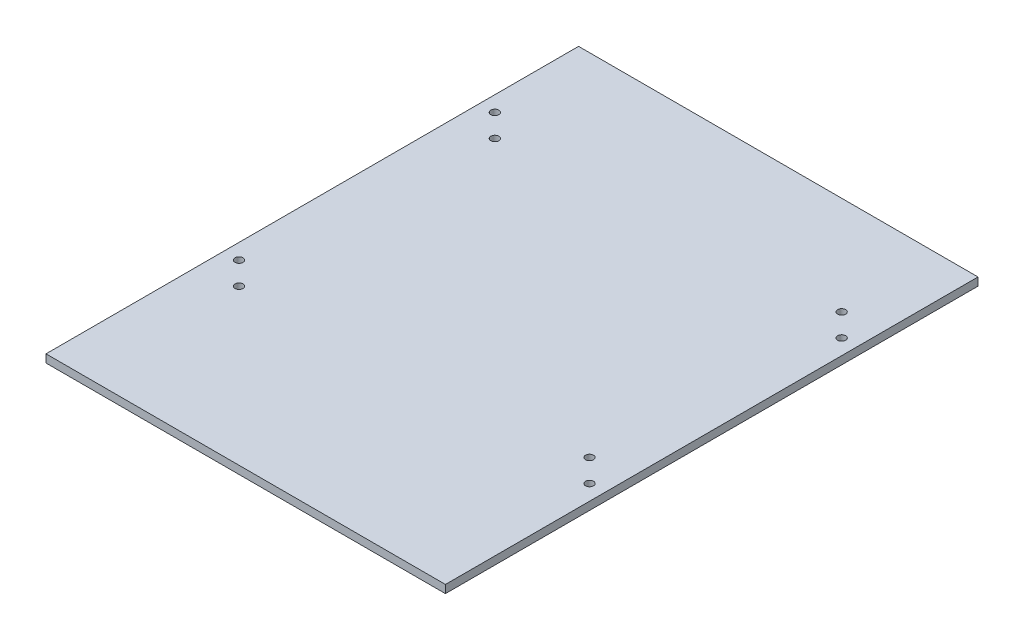
from build123d import *

# Parameters (mm, degrees)
SKETCH1_W           = 150
SKETCH1_H           = 200
SKETCH1_R           = 1.5
BOSS_EXTRUDE1_DEPTH = 3


with BuildPart() as part:
    # Sketch1 → Boss-Extrude1 (new body)
    with BuildSketch(Plane(origin=(0, 0, 0), x_dir=(1, 0, 0), z_dir=(0, 1, 0))):
        Rectangle(SKETCH1_W, SKETCH1_H)
        with Locations((-69.242640687, 62.79605759)):
            Circle(SKETCH1_R, mode=Mode.SUBTRACT)
        with Locations((-60.757359313, 54.310776216)):
            Circle(SKETCH1_R, mode=Mode.SUBTRACT)
        with Locations((60.757359313, 63.034810844)):
            Circle(SKETCH1_R, mode=Mode.SUBTRACT)
        with Locations((69.242640687, 54.54952947)):
            Circle(SKETCH1_R, mode=Mode.SUBTRACT)
        with Locations((-69.242640687, -33.274226936)):
            Circle(SKETCH1_R, mode=Mode.SUBTRACT)
        with Locations((-60.757359313, -41.75950831)):
            Circle(SKETCH1_R, mode=Mode.SUBTRACT)
        with Locations((60.757359313, -31.641853854)):
            Circle(SKETCH1_R, mode=Mode.SUBTRACT)
        with Locations((69.242640687, -40.127135228)):
            Circle(SKETCH1_R, mode=Mode.SUBTRACT)
    extrude(amount=BOSS_EXTRUDE1_DEPTH)


solid = part.part
